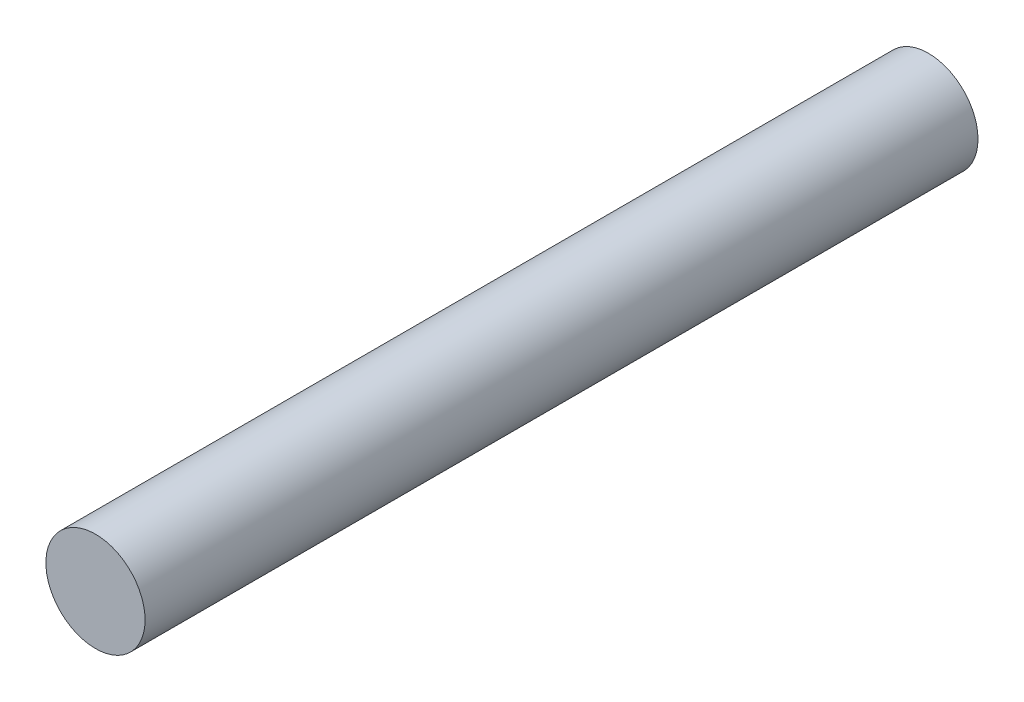
from build123d import *

# Parameters (mm, degrees)
SKETCH1_R           = 4.7625
BOSS_EXTRUDE1_DEPTH = 80


with BuildPart() as part:
    # Sketch1 → Boss-Extrude1 (new body)
    with BuildSketch(Plane.XY):
        Circle(SKETCH1_R)
    extrude(amount=BOSS_EXTRUDE1_DEPTH)


solid = part.part
